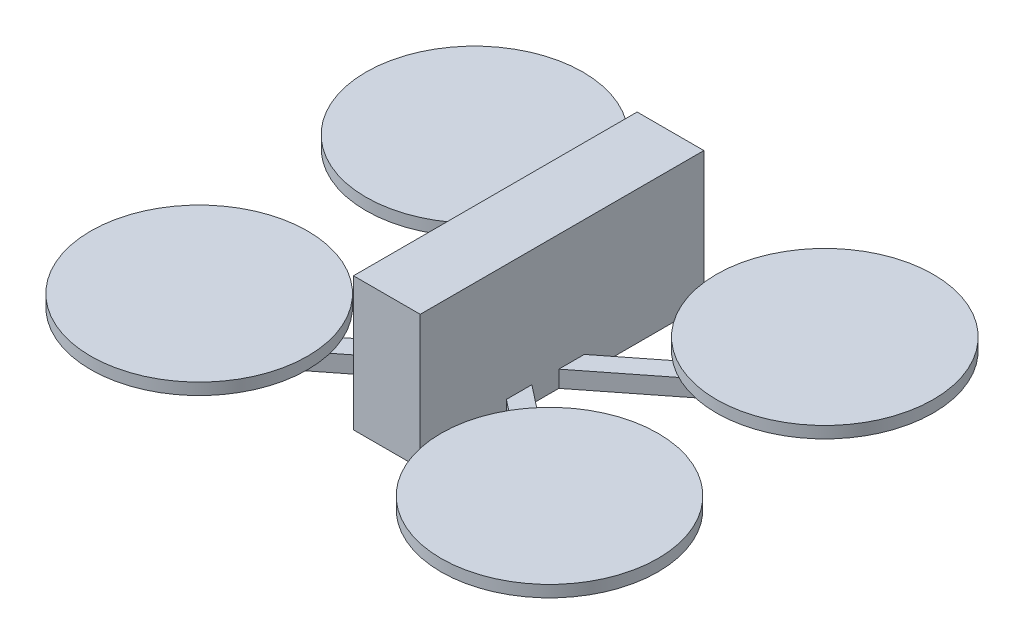
from build123d import *

# Parameters (mm, degrees)
SKETCH2_W           = 40
SKETCH2_H           = 170
BOSS_EXTRUDE2_DEPTH = 80
BOSS_EXTRUDE3_DEPTH = 10
SKETCH2_4_R         = 15
BOSS_EXTRUDE4_DEPTH = 25
SKETCH3_R           = 65
BOSS_EXTRUDE5_DEPTH = 7


with BuildPart() as part:
    # Sketch2 → Boss-Extrude2 (new body)
    with BuildSketch(Plane(origin=(0, 0, 0), x_dir=(1, 0, 0), z_dir=(0, 1, 0))):
        with Locations((0, 10)):
            Rectangle(SKETCH2_W, SKETCH2_H)
    extrude(amount=BOSS_EXTRUDE2_DEPTH)

    # Sketch2<3> → Boss-Extrude3 (add)
    with BuildSketch(Plane(origin=(0, 0, 0), x_dir=(1, 0, 0), z_dir=(0, 1, 0))):
        with BuildLine():
            ThreePointArc((-90.482980764, 78.72426795), (-93.205224918, 73.232676721), (-97.896839388, 69.288447884))
            Line((-97.896839388, 69.288447884), (-20, 8.083788365))
            Line((-20, 8.083788365), (-20, 23.344783063))
            Line((-20, 23.344783063), (-90.482980764, 78.72426795))
        make_face()
        with BuildLine():
            Line((-20, -8.083788365), (-97.896839388, -69.288447884))
            ThreePointArc((-97.896839388, -69.288447884), (-93.205224918, -73.232676721), (-90.482980764, -78.72426795))
            Line((-90.482980764, -78.72426795), (-20, -23.344783063))
            Line((-20, -23.344783063), (-20, -8.083788365))
        make_face()
        with BuildLine():
            Line((90.482980764, 78.72426795), (20, 23.344783063))
            Line((20, 23.344783063), (20, 8.083788365))
            Line((20, 8.083788365), (97.896839388, 69.288447884))
            ThreePointArc((97.896839388, 69.288447884), (93.205224918, 73.232676721), (90.482980764, 78.72426795))
        make_face()
        with BuildLine():
            Line((20, -8.083788365), (20, -23.344783063))
            Line((20, -23.344783063), (90.482980764, -78.72426795))
            ThreePointArc((90.482980764, -78.72426795), (93.205224918, -73.232676721), (97.896839388, -69.288447884))
            Line((97.896839388, -69.288447884), (20, -8.083788365))
        make_face()
    extrude(amount=BOSS_EXTRUDE3_DEPTH)

    # Sketch2<4> → Boss-Extrude4 (add)
    with BuildSketch(Plane(origin=(0, 0, 0), x_dir=(1, 0, 0), z_dir=(0, 1, 0))):
        with Locations((-105, 82.5)):
            Circle(SKETCH2_4_R)
        with Locations((105, 82.5)):
            Circle(SKETCH2_4_R)
        with Locations((105, -82.5)):
            Circle(SKETCH2_4_R)
        with Locations((-105, -82.5)):
            Circle(SKETCH2_4_R)
    extrude(amount=BOSS_EXTRUDE4_DEPTH)

    # Sketch3 → Boss-Extrude5 (add)
    with BuildSketch(Plane(origin=(0, 25, 0), x_dir=(1, 0, 0), z_dir=(0, 1, 0))):
        with Locations((-105, -82.5)):
            Circle(SKETCH3_R)
        with Locations((105, -82.5)):
            Circle(SKETCH3_R)
        with Locations((105, 82.5)):
            Circle(SKETCH3_R)
        with Locations((-105, 82.5)):
            Circle(SKETCH3_R)
    extrude(amount=BOSS_EXTRUDE5_DEPTH)


solid = part.part
